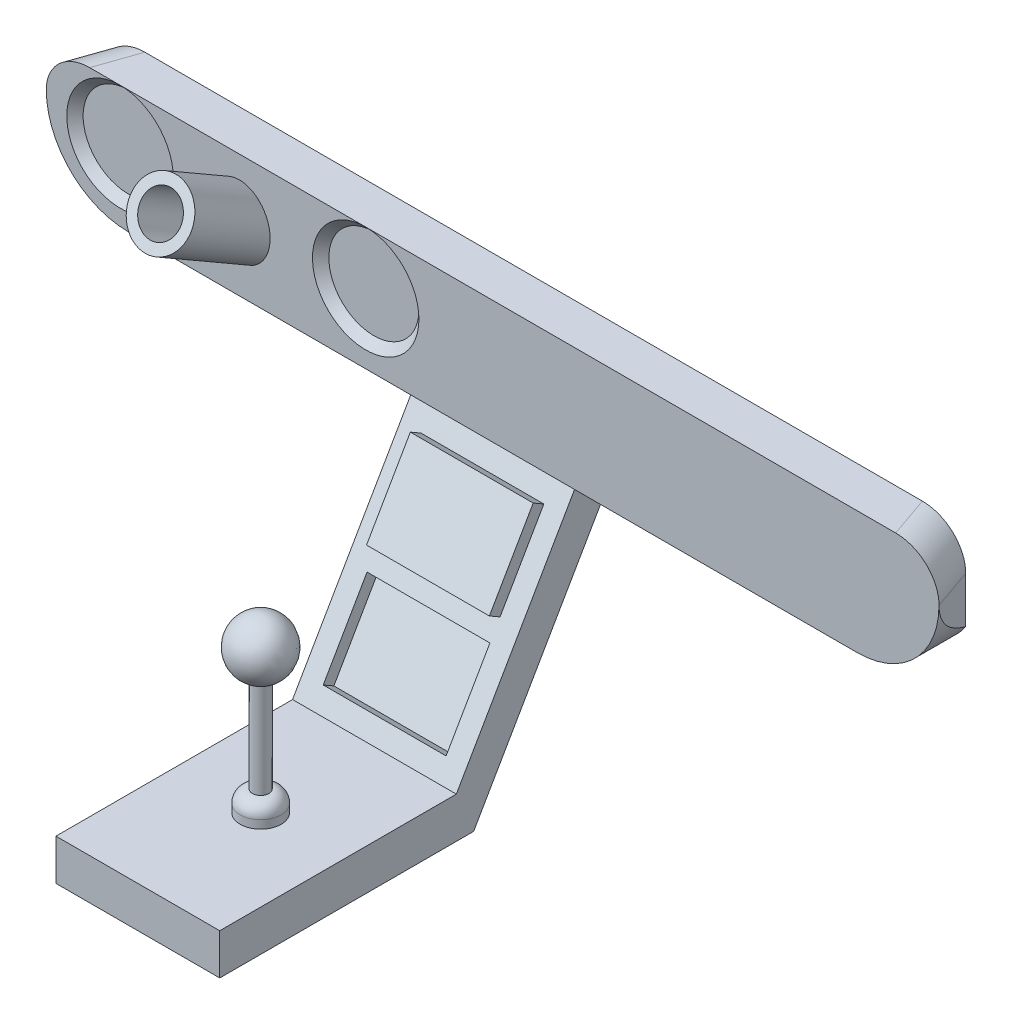
from build123d import *

# Parameters (mm, degrees)
SKETCH2_W           = 218
SKETCH2_H           = 30
BOSS_EXTRUDE1_DEPTH = 5
FILLET1_R           = 20
SKETCH3_R           = 10
CUT_EXTRUDE1_DEPTH  = 2
CHAMFER1_SIZE       = 3
SKETCH6_R           = 5
CUT_EXTRUDE2_DEPTH  = 119.749210232
BOSS_EXTRUDE2_DEPTH = 20
SKETCH8_W           = 30
SKETCH8_H           = 21.4
BOSS_EXTRUDE4_DEPTH = 3
SKETCH9_W           = 30
SKETCH9_H           = 21.4
CUT_EXTRUDE3_DEPTH  = 3
CUT_EXTRUDE4_DEPTH  = 40
FILLET2_R           = 10
CUT_EXTRUDE5_DEPTH  = 40
FILLET3_R           = 10


with BuildPart() as part:
    # Sketch2 → Boss-Extrude1 (new, symmetric)
    with BuildSketch(Plane.XY):
        Rectangle(SKETCH2_W, SKETCH2_H)
    extrude(amount=BOSS_EXTRUDE1_DEPTH, both=True)

    # Fillet1
    fillet1_edges = [part.edges().sort_by_distance(p)[0] for p in [
        (109, -15, 0),
        (-109, -15, 0),
    ]]
    fillet(fillet1_edges, radius=FILLET1_R)

    # Sketch3 → Cut-Extrude1 (cut, symmetric)
    with BuildSketch(Plane.XY.offset(5)):
        with Locations((-91, 2)):
            Circle(SKETCH3_R)
        with Locations((-31, 2)):
            Circle(SKETCH3_R)
    extrude(amount=CUT_EXTRUDE1_DEPTH, both=True, mode=Mode.SUBTRACT)

    # Chamfer1
    # the kernel refuses this chamfer: 3 mm, written as the material it takes off along each edge
    with BuildSketch(Plane(origin=(-31, 2, 5), x_dir=(1, 0, 0), z_dir=(0, -1, 0))) as chamfer1_piece_1_section:
        Polygon((10 + CHAMFER1_SIZE, 0), (10, -CHAMFER1_SIZE), (10, 0), align=None)
    chamfer1_piece_1 = revolve(axis=Axis((-31, 2, 5), (0, 0, 1)), mode=Mode.PRIVATE)
    chamfer1_piece_1 = split(chamfer1_piece_1, bisect_by=Plane(origin=(-42.994962735, 2, 3), z_dir=(0, 0, 1)), keep=Keep.TOP, mode=Mode.PRIVATE)
    add(chamfer1_piece_1, mode=Mode.SUBTRACT)
    with BuildSketch(Plane(origin=(-91, 2, 5), x_dir=(1, 0, 0), z_dir=(0, -1, 0))) as chamfer1_piece_2_section:
        Polygon((10 + CHAMFER1_SIZE, 0), (10, -CHAMFER1_SIZE), (10, 0), align=None)
    chamfer1_piece_2 = revolve(axis=Axis((-91, 2, 5), (0, 0, 1)), mode=Mode.PRIVATE)
    chamfer1_piece_2 = split(chamfer1_piece_2, bisect_by=Plane(origin=(-102.994962728, 2, 3), z_dir=(0, 0, 1)), keep=Keep.TOP, mode=Mode.PRIVATE)
    add(chamfer1_piece_2, mode=Mode.SUBTRACT)

    # Sketch5 → Revolve1 (revolve)
    with BuildSketch(Plane(origin=(-61.85, 0, 0), x_dir=(0, 0, -1), z_dir=(1, 0, 0)), mode=Mode.PRIVATE) as revolve1_sk:
        Polygon((-20.498711306, 18.495190528), (-24.248711306, 12), (10.392304845, -8), (14.142304845, -1.504809472), align=None)
    revolve(revolve1_sk.sketch.rotate(Axis((-61.85, 12, 24.248711306), (0, -0.4999999999999977, -0.86602540378444)), 180), axis=Axis((-61.85, 12, 24.248711306), (0, -0.4999999999999977, -0.86602540378444)))

    # Sketch6 → Cut-Extrude2 (cut, through all)
    with BuildSketch(Plane(origin=(0, 13.5, 23.382685902), x_dir=(1, 0, 0), z_dir=(0, 0.4999999999999978, 0.86602540378444))):
        with Locations(Location((-61.85, -1.732050808, 0), (0, 0, 270))):
            Circle(SKETCH6_R)
    extrude(amount=-CUT_EXTRUDE2_DEPTH, mode=Mode.SUBTRACT)

    # Sketch7 → Boss-Extrude2 (add, symmetric)
    with BuildSketch(Plane(origin=(0, 0, 0), x_dir=(0, 0, -1), z_dir=(1, 0, 0))):
        Polygon((5, -15), (-5, -15), (-33.867513459, -65), (-91.641016151, -65), (-91.641016151, -75), (-29.641016151, -75), align=None)
    extrude(amount=BOSS_EXTRUDE2_DEPTH, both=True)

    # Sketch8 → Boss-Extrude4 (add)
    with BuildSketch(Plane(origin=(0, -1.584936491, -2.745190528), x_dir=(1, 0, 0), z_dir=(0, 0.49999999999999756, 0.86602540378444))):
        with Locations((0, -31.190381057)):
            Rectangle(SKETCH8_W, SKETCH8_H)
    extrude(amount=BOSS_EXTRUDE4_DEPTH)

    # Sketch9 → Cut-Extrude3 (cut)
    with BuildSketch(Plane(origin=(0, -1.584936491, -2.745190528), x_dir=(1, 0, 0), z_dir=(0, 0.49999999999999756, 0.86602540378444))):
        with Locations((0, -57.525407976)):
            Rectangle(SKETCH9_W, SKETCH9_H)
    extrude(amount=-CUT_EXTRUDE3_DEPTH, mode=Mode.SUBTRACT)

    # Sketch10 → Revolve2 (revolve)
    with BuildSketch(Plane(origin=(0, 0, 0), x_dir=(0, 0, -1), z_dir=(1, 0, 0)), mode=Mode.PRIVATE) as revolve2_sk:
        with BuildLine():
            Line((-61.641016151, -23.080849404), (-61.641016151, -85))
            Line((-61.641016151, -85), (-54.141016151, -85))
            Line((-54.141016151, -85), (-54.141016151, -75))
            Line((-54.141016151, -75), (-56.641016151, -75))
            Line((-56.641016151, -75), (-56.641016151, -63))
            ThreePointArc((-56.641016151, -63), (-57.519695808, -60.878679656), (-59.641016151, -60))
            Line((-59.641016151, -60), (-59.641016151, -36.590975833))
            ThreePointArc((-59.641016151, -36.590975833), (-54.904038671, -28.986627083), (-61.641016151, -23.080849404))
        make_face()
    revolve(revolve2_sk.sketch.rotate(Axis((0, -23.080849404, 61.641016151), (0, -1, 0)), 180), axis=Axis((0, -23.080849404, 61.641016151), (0, -1, 0)))

    # Sketch11 → Cut-Extrude4 (cut)
    with BuildSketch(Plane(origin=(0, 15, 0), x_dir=(1, 0, 0), z_dir=(0, 1, 0))):
        Polygon((-109, 5), (-109, -5), (-105.52, 5), align=None)
    extrude(amount=-CUT_EXTRUDE4_DEPTH, mode=Mode.SUBTRACT)

    # Fillet2
    fillet2_edges = [part.edges().sort_by_distance(p)[0] for p in [
        (-107.26, 15, 0),
    ]]
    fillet(fillet2_edges, radius=FILLET2_R)

    # Sketch13 → Cut-Extrude5 (cut)
    with BuildSketch(Plane(origin=(0, 15, 0), x_dir=(1, 0, 0), z_dir=(0, 1, 0))):
        Polygon((109, 5), (109, -5), (105.52, 5), align=None)
    extrude(amount=-CUT_EXTRUDE5_DEPTH, mode=Mode.SUBTRACT)

    # Fillet3
    fillet3_edges = [part.edges().sort_by_distance(p)[0] for p in [
        (107.26, 15, 0),
    ]]
    fillet(fillet3_edges, radius=FILLET3_R)


solid = part.part
